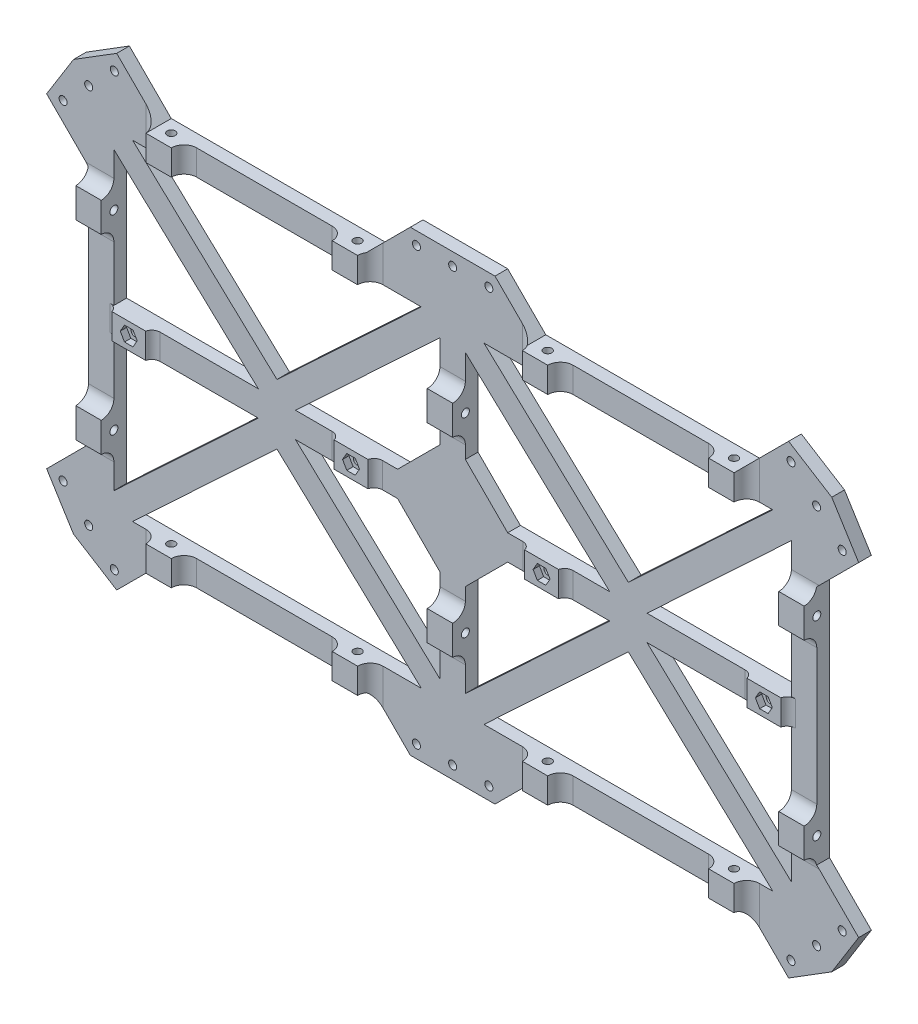
from build123d import *

# Parameters (mm, degrees)
ESQUISSE1_W             = 172
ESQUISSE1_H             = 90
BOSS_EXTRU_1_DEPTH      = 3
ESQUISSE2_R             = 0.95
BOSS_EXTRU_2_DEPTH      = 3
ESQUISSE3_R             = 0.95
ENL_V_MAT_EXTRU_1_DEPTH = 3
ENL_V_MAT_EXTRU_2_REACH = 112.527
ESQUISSE4_R             = 0.95
ESQUISSE5_W             = 8
ESQUISSE5_H             = 6
BOSS_EXTRU_3_DEPTH      = 1.5
CONG_1_R                = 2
ESQUISSE6_W             = 6
ESQUISSE6_H             = 7
ESQUISSE6_H_2           = 6
BOSS_EXTRU_4_DEPTH      = 3
ENL_V_MAT_EXTRU_3_REACH = 140.593
ESQUISSE7_R             = 0.95
ENL_V_MAT_EXTRU_4_REACH = 140.593
ESQUISSE8_R             = 0.95
CONG_2_R                = 3
ENL_V_MAT_EXTRU_5_REACH = 192.084
ESQUISSE9_R             = 0.95
ENL_V_MAT_EXTRU_6_REACH = 115.259
ESQUISSE10_R            = 0.95
ENL_V_MAT_EXTRU_7_REACH = 186.351
ESQUISSE11_R            = 0.95


with BuildPart() as part:
    # Esquisse1 → Boss.-Extru.1 (new body)
    with BuildSketch(Plane.XY):
        Rectangle(ESQUISSE1_W, ESQUISSE1_H)
        Polygon((-7.392425614, -39), (-75.607574386, -39), (-58.857104999, -23.337223431), (-58.701018232, -23.191272168), (-41.5, -7.107203172), align=None, mode=Mode.SUBTRACT)
        Polygon((-80, -34.892796828), (-80, -3), (-45.892425614, -3), (-62.798981768, -18.808727832), align=None, mode=Mode.SUBTRACT)
        Polygon((-3, -3), (-3, -34.892796828), (-37.107574386, -3), align=None, mode=Mode.SUBTRACT)
        Polygon((41.5, -7.107203172), (58.701018232, -23.191272168), (58.857104999, -23.337223431), (75.607574386, -39), (7.392425614, -39), align=None, mode=Mode.SUBTRACT)
        Polygon((37.107574386, -3), (3, -34.892796828), (3, -3), align=None, mode=Mode.SUBTRACT)
        Polygon((80, -34.892796828), (62.798981768, -18.808727832), (45.892425614, -3), (80, -3), align=None, mode=Mode.SUBTRACT)
        Polygon((-80, 3), (-80, 34.892796828), (-62.798981768, 18.808727832), (-45.892425614, 3), align=None, mode=Mode.SUBTRACT)
        Polygon((-34.550705308, 5.390838618), (-3, 34.892796828), (-3, 3), (-37.107574386, 3), align=None, mode=Mode.SUBTRACT)
        Polygon((-58.857104999, 23.337223431), (-75.607574386, 39), (-7.392425614, 39), (-41.5, 7.107203172), (-58.701018232, 23.191272168), align=None, mode=Mode.SUBTRACT)
        Polygon((3, 3), (3, 34.892796828), (34.550705308, 5.390838618), (37.107574386, 3), align=None, mode=Mode.SUBTRACT)
        Polygon((62.798981768, 18.808727832), (80, 34.892796828), (80, 3), (45.892425614, 3), align=None, mode=Mode.SUBTRACT)
        Polygon((75.607574386, 39), (58.857104999, 23.337223431), (58.701018232, 23.191272168), (41.5, 7.107203172), (7.392425614, 39), align=None, mode=Mode.SUBTRACT)
    extrude(amount=BOSS_EXTRU_1_DEPTH)

    # Esquisse2 → Boss.-Extru.2 (add)
    # profile 1 of 10: a face of its own
    with BuildSketch(Plane.XY.offset(3)):
        with BuildLine():
            Line((-85.005339898, 45), (-69.45370132, 45))
            Line((-69.45370132, 45), (-79.341722304, 54.888020984))
            Line((-79.341722304, 54.888020984), (-89.535533906, 48.535533906))
            Line((-89.535533906, 48.535533906), (-95.888020984, 38.341722304))
            Line((-95.888020984, 38.341722304), (-86, 28.45370132))
            Line((-86, 28.45370132), (-86, 44.005339898))
            ThreePointArc((-86, 44.005339898), (-86.625988463, 45.625988463), (-85.005339898, 45))
        make_face()
        with Locations((-92, 38.908474042)):
            Circle(ESQUISSE2_R, mode=Mode.SUBTRACT)
        with Locations((-79.908474042, 51)):
            Circle(ESQUISSE2_R, mode=Mode.SUBTRACT)
    # profile 2 of 10: a face of its own
    with BuildSketch(Plane.XY.offset(3)):
        Polygon((10, 54), (0, 54), (-10, 54), (-19, 45), (-10.3, 45), (10.3, 45), (19, 45), align=None)
        with Locations((-8.55, 51)):
            Circle(ESQUISSE2_R, mode=Mode.SUBTRACT)
        with Locations((0, 51)):
            Circle(ESQUISSE2_R, mode=Mode.SUBTRACT)
        with Locations((8.55, 51)):
            Circle(ESQUISSE2_R, mode=Mode.SUBTRACT)
    # profile 3 of 10: a face of its own
    with BuildSketch(Plane.XY.offset(3)):
        with BuildLine():
            Line((79.341722304, 54.888020984), (69.45370132, 45))
            Line((69.45370132, 45), (85.005339898, 45))
            ThreePointArc((85.005339898, 45), (85.977125154, 45.903961262), (86.904237021, 44.954237021))
            ThreePointArc((86.904237021, 44.954237021), (86.641977826, 44.298864924), (86, 44.005339898))
            Line((86, 44.005339898), (86, 28.45370132))
            Line((86, 28.45370132), (95.888020984, 38.341722304))
            Line((95.888020984, 38.341722304), (89.535533906, 48.535533906))
            Line((89.535533906, 48.535533906), (79.341722304, 54.888020984))
        make_face()
        with Locations((92, 38.908474042)):
            Circle(ESQUISSE2_R, mode=Mode.SUBTRACT)
        with Locations((79.908474042, 51)):
            Circle(ESQUISSE2_R, mode=Mode.SUBTRACT)
    # profile 4 of 10: a face of its own
    with BuildSketch(Plane.XY.offset(3)):
        with BuildLine():
            Line((95.888020984, -38.341722304), (86, -28.45370132))
            Line((86, -28.45370132), (86, -44.005339898))
            ThreePointArc((86, -44.005339898), (86.641977826, -44.298864924), (86.904237021, -44.954237021))
            ThreePointArc((86.904237021, -44.954237021), (85.977125154, -45.903961262), (85.005339898, -45))
            Line((85.005339898, -45), (69.45370132, -45))
            Line((69.45370132, -45), (79.341722304, -54.888020984))
            Line((79.341722304, -54.888020984), (89.535533906, -48.535533906))
            Line((89.535533906, -48.535533906), (95.888020984, -38.341722304))
        make_face()
        with Locations((79.908474042, -51)):
            Circle(ESQUISSE2_R, mode=Mode.SUBTRACT)
        with Locations((92, -38.908474042)):
            Circle(ESQUISSE2_R, mode=Mode.SUBTRACT)
    # profile 5 of 10: a face of its own
    with BuildSketch(Plane.XY.offset(3)):
        Polygon((19, -45), (-19, -45), (-10, -54), (0, -54), (10, -54), align=None)
        with Locations((-8.55, -51)):
            Circle(ESQUISSE2_R, mode=Mode.SUBTRACT)
        with Locations((0, -51)):
            Circle(ESQUISSE2_R, mode=Mode.SUBTRACT)
        with Locations((8.55, -51)):
            Circle(ESQUISSE2_R, mode=Mode.SUBTRACT)
    # profile 6 of 10: a face of its own
    with BuildSketch(Plane.XY.offset(3)):
        with BuildLine():
            Line((-86, -44.005339898), (-86, -28.45370132))
            Line((-86, -28.45370132), (-95.888020984, -38.341722304))
            Line((-95.888020984, -38.341722304), (-89.535533906, -48.535533906))
            Line((-89.535533906, -48.535533906), (-79.341722304, -54.888020984))
            Line((-79.341722304, -54.888020984), (-69.45370132, -45))
            Line((-69.45370132, -45), (-85.005339898, -45))
            ThreePointArc((-85.005339898, -45), (-86.625988463, -45.625988463), (-86, -44.005339898))
        make_face()
        with Locations((-79.908474042, -51)):
            Circle(ESQUISSE2_R, mode=Mode.SUBTRACT)
        with Locations((-92, -38.908474042)):
            Circle(ESQUISSE2_R, mode=Mode.SUBTRACT)
    # profile 7 of 10: a face of its own
    with BuildSketch(Plane.XY.offset(3)):
        Polygon((-3, -3), (-13, -3), (-3, -13), align=None)
    # profile 8 of 10: a face of its own
    with BuildSketch(Plane.XY.offset(3)):
        Polygon((3, -3), (3, -13), (13, -3), align=None)
    # profile 9 of 10: a face of its own
    with BuildSketch(Plane.XY.offset(3)):
        Polygon((13, 3), (3, 13), (3, 3), align=None)
    # profile 10 of 10: a face of its own
    with BuildSketch(Plane.XY.offset(3)):
        Polygon((-3, 13), (-13, 3), (-3, 3), align=None)
    extrude(amount=-BOSS_EXTRU_2_DEPTH)

    # Esquisse3 → Enlèv. mat.-Extru.1 (cut)
    with BuildSketch(Plane.XY.offset(3)):
        with Locations((-85.954237021, 44.954237021)):
            Circle(ESQUISSE3_R)
        with Locations((85.954237021, 44.954237021)):
            Circle(ESQUISSE3_R)
        with Locations((85.954237021, -44.954237021)):
            Circle(ESQUISSE3_R)
        with Locations((-85.954237021, -44.954237021)):
            Circle(ESQUISSE3_R)
    extrude(amount=-ENL_V_MAT_EXTRU_1_DEPTH, mode=Mode.SUBTRACT)

    # Esquisse4 → Enlèv. mat.-Extru.2 (cut, up to next)
    with BuildSketch(Plane.XY.offset(3), mode=Mode.PRIVATE) as enl_v_mat_extru_2_sk1:
        with Locations((-22.5, 0)):
            Circle(ESQUISSE4_R)
    enl_v_mat_extru_2_tool1 = extrude(enl_v_mat_extru_2_sk1.sketch, amount=-ENL_V_MAT_EXTRU_2_REACH, mode=Mode.PRIVATE) & part.part
    # Esquisse4 → Enlèv. mat.-Extru.2 (cut, up to next)
    with BuildSketch(Plane.XY.offset(3), mode=Mode.PRIVATE) as enl_v_mat_extru_2_sk2:
        with Locations((-75, 0)):
            Circle(ESQUISSE4_R)
    enl_v_mat_extru_2_tool2 = extrude(enl_v_mat_extru_2_sk2.sketch, amount=-ENL_V_MAT_EXTRU_2_REACH, mode=Mode.PRIVATE) & part.part
    # Esquisse4 → Enlèv. mat.-Extru.2 (cut, up to next)
    with BuildSketch(Plane.XY.offset(3), mode=Mode.PRIVATE) as enl_v_mat_extru_2_sk3:
        with Locations((22.5, 0)):
            Circle(ESQUISSE4_R)
    enl_v_mat_extru_2_tool3 = extrude(enl_v_mat_extru_2_sk3.sketch, amount=-ENL_V_MAT_EXTRU_2_REACH, mode=Mode.PRIVATE) & part.part
    # Esquisse4 → Enlèv. mat.-Extru.2 (cut, up to next)
    with BuildSketch(Plane.XY.offset(3), mode=Mode.PRIVATE) as enl_v_mat_extru_2_sk4:
        with Locations((75, 0)):
            Circle(ESQUISSE4_R)
    enl_v_mat_extru_2_tool4 = extrude(enl_v_mat_extru_2_sk4.sketch, amount=-ENL_V_MAT_EXTRU_2_REACH, mode=Mode.PRIVATE) & part.part
    add(enl_v_mat_extru_2_tool1.solids().sort_by_distance((-22.5, 0, 3))[0], mode=Mode.SUBTRACT)
    add(enl_v_mat_extru_2_tool2.solids().sort_by_distance((-75, 0, 3))[0], mode=Mode.SUBTRACT)
    add(enl_v_mat_extru_2_tool3.solids().sort_by_distance((22.5, 0, 3))[0], mode=Mode.SUBTRACT)
    add(enl_v_mat_extru_2_tool4.solids().sort_by_distance((75, 0, 3))[0], mode=Mode.SUBTRACT)

    # Esquisse5 → Boss.-Extru.3 (add)
    # profile 1 of 4: a face of its own
    with BuildSketch(Plane.XY.offset(3)):
        with Locations((-22.5, 0)):
            Rectangle(ESQUISSE5_W, ESQUISSE5_H)
        Polygon((-20.5, 0), (-21.5, 1.732050808), (-23.5, 1.732050808), (-24.5, 0), (-23.5, -1.732050808), (-21.5, -1.732050808), align=None, mode=Mode.SUBTRACT)
    # profile 2 of 4: a face of its own
    with BuildSketch(Plane.XY.offset(3)):
        with Locations((-75, 0)):
            Rectangle(ESQUISSE5_W, ESQUISSE5_H)
        Polygon((-73, 0), (-74, 1.732050808), (-76, 1.732050808), (-77, 0), (-76, -1.732050808), (-74, -1.732050808), align=None, mode=Mode.SUBTRACT)
    # profile 3 of 4: a face of its own
    with BuildSketch(Plane.XY.offset(3)):
        with Locations((22.5, 0)):
            Rectangle(ESQUISSE5_W, ESQUISSE5_H)
        Polygon((21.5, -1.732050808), (20.5, 0), (21.5, 1.732050808), (23.5, 1.732050808), (24.5, 0), (23.5, -1.732050808), align=None, mode=Mode.SUBTRACT)
    # profile 4 of 4: a face of its own
    with BuildSketch(Plane.XY.offset(3)):
        with Locations((75, 0)):
            Rectangle(ESQUISSE5_W, ESQUISSE5_H)
        Polygon((74, -1.732050808), (73, 0), (74, 1.732050808), (76, 1.732050808), (77, 0), (76, -1.732050808), align=None, mode=Mode.SUBTRACT)
    extrude(amount=BOSS_EXTRU_3_DEPTH)

    # Congé1
    # the kernel refuses this fillet: 2 mm, written as the material it adds along each edge
    with BuildSketch(Plane(origin=(-26.5, -3, 3), x_dir=(-1, 0, 0), z_dir=(0, 1, 0)), Plane(origin=(-18.5, 3, 3), x_dir=(1, 0, 0), z_dir=(0, -1, 0)), Plane(origin=(-79, -3, 3), x_dir=(-1, 0, 0), z_dir=(0, 1, 0)), Plane(origin=(-71, 3, 3), x_dir=(1, 0, 0), z_dir=(0, -1, 0))) as cong_1_piece_1:
        with BuildLine():
            CenterArc((1.936491673, 2), CONG_1_R, 194.477512186, 75.522487814)
            Line((0, 1.5), (0, 0))
            Line((0, 0), (1.936491673, 0))
        make_face()
    extrude(amount=6)
    with BuildSketch(Plane(origin=(18.5, 3, 3), x_dir=(-1, 0, 0), z_dir=(0, -1, 0)), Plane(origin=(26.5, -3, 3), x_dir=(1, 0, 0), z_dir=(0, 1, 0)), Plane(origin=(71, 3, 3), x_dir=(-1, 0, 0), z_dir=(0, -1, 0)), Plane(origin=(79, -3, 3), x_dir=(1, 0, 0), z_dir=(0, 1, 0))) as cong_1_piece_2:
        with BuildLine():
            CenterArc((1.936491673, -2), CONG_1_R, 90, 75.522487814)
            Line((0, -1.5), (0, 0))
            Line((0, 0), (1.936491673, 0))
        make_face()
    extrude(amount=6)

    # Esquisse6 → Boss.-Extru.4 (add)
    with BuildSketch(Plane.XY.offset(3)):
        with Locations((-83, -22.5)):
            Rectangle(ESQUISSE6_W, ESQUISSE6_H)
        with Locations((-83, 22.5)):
            Rectangle(ESQUISSE6_W, ESQUISSE6_H)
        with Locations((83, -22.5)):
            Rectangle(ESQUISSE6_W, ESQUISSE6_H)
        with Locations((83, 22.5)):
            Rectangle(ESQUISSE6_W, ESQUISSE6_H)
        with Locations((-66.45370132, 42)):
            Rectangle(ESQUISSE6_W, ESQUISSE6_H_2)
        with Locations((22.45370132, 42)):
            Rectangle(ESQUISSE6_W, ESQUISSE6_H_2)
        with Locations((-22.45370132, 42)):
            Rectangle(ESQUISSE6_W, ESQUISSE6_H_2)
        with Locations((66.45370132, 42)):
            Rectangle(ESQUISSE6_W, ESQUISSE6_H_2)
        with Locations((66.45370132, -42)):
            Rectangle(ESQUISSE6_W, ESQUISSE6_H_2)
        with Locations((22.45370132, -42)):
            Rectangle(ESQUISSE6_W, ESQUISSE6_H_2)
        with Locations((-22.45370132, -42)):
            Rectangle(ESQUISSE6_W, ESQUISSE6_H_2)
        with Locations((-66.45370132, -42)):
            Rectangle(ESQUISSE6_W, ESQUISSE6_H_2)
        with Locations((0, 22.5)):
            Rectangle(ESQUISSE6_W, ESQUISSE6_H)
        with Locations((0, -22.5)):
            Rectangle(ESQUISSE6_W, ESQUISSE6_H)
    extrude(amount=BOSS_EXTRU_4_DEPTH)

    # Esquisse7 → Enlèv. mat.-Extru.3 (cut, up to next)
    with BuildSketch(Plane.XZ.offset(45), mode=Mode.PRIVATE) as enl_v_mat_extru_3_sk1:
        with Locations(Location((-66.45370132, 3, 0), (0, 0, 270))):
            Circle(ESQUISSE7_R)
    enl_v_mat_extru_3_tool1 = extrude(enl_v_mat_extru_3_sk1.sketch, amount=-ENL_V_MAT_EXTRU_3_REACH, mode=Mode.PRIVATE) & part.part
    # Esquisse7 → Enlèv. mat.-Extru.3 (cut, up to next)
    with BuildSketch(Plane.XZ.offset(45), mode=Mode.PRIVATE) as enl_v_mat_extru_3_sk2:
        with Locations(Location((-22.45370132, 3, 0), (0, 0, 270))):
            Circle(ESQUISSE7_R)
    enl_v_mat_extru_3_tool2 = extrude(enl_v_mat_extru_3_sk2.sketch, amount=-ENL_V_MAT_EXTRU_3_REACH, mode=Mode.PRIVATE) & part.part
    # Esquisse7 → Enlèv. mat.-Extru.3 (cut, up to next)
    with BuildSketch(Plane.XZ.offset(45), mode=Mode.PRIVATE) as enl_v_mat_extru_3_sk3:
        with Locations(Location((22.45370132, 3, 0), (0, 0, 270))):
            Circle(ESQUISSE7_R)
    enl_v_mat_extru_3_tool3 = extrude(enl_v_mat_extru_3_sk3.sketch, amount=-ENL_V_MAT_EXTRU_3_REACH, mode=Mode.PRIVATE) & part.part
    # Esquisse7 → Enlèv. mat.-Extru.3 (cut, up to next)
    with BuildSketch(Plane.XZ.offset(45), mode=Mode.PRIVATE) as enl_v_mat_extru_3_sk4:
        with Locations(Location((66.45370132, 3, 0), (0, 0, 270))):
            Circle(ESQUISSE7_R)
    enl_v_mat_extru_3_tool4 = extrude(enl_v_mat_extru_3_sk4.sketch, amount=-ENL_V_MAT_EXTRU_3_REACH, mode=Mode.PRIVATE) & part.part
    add(enl_v_mat_extru_3_tool1.solids().sort_by_distance((-66.453701, -45, 3))[0], mode=Mode.SUBTRACT)
    add(enl_v_mat_extru_3_tool2.solids().sort_by_distance((-22.453701, -45, 3))[0], mode=Mode.SUBTRACT)
    add(enl_v_mat_extru_3_tool3.solids().sort_by_distance((22.453701, -45, 3))[0], mode=Mode.SUBTRACT)
    add(enl_v_mat_extru_3_tool4.solids().sort_by_distance((66.453701, -45, 3))[0], mode=Mode.SUBTRACT)

    # Esquisse8 → Enlèv. mat.-Extru.4 (cut, up to next)
    with BuildSketch(Plane(origin=(0, 45, 0), x_dir=(1, 0, 0), z_dir=(0, 1, 0)), mode=Mode.PRIVATE) as enl_v_mat_extru_4_sk1:
        with Locations(Location((66.45370132, -3, 0), (0, 0, 90))):
            Circle(ESQUISSE8_R)
    enl_v_mat_extru_4_tool1 = extrude(enl_v_mat_extru_4_sk1.sketch, amount=-ENL_V_MAT_EXTRU_4_REACH, mode=Mode.PRIVATE) & part.part
    # Esquisse8 → Enlèv. mat.-Extru.4 (cut, up to next)
    with BuildSketch(Plane(origin=(0, 45, 0), x_dir=(1, 0, 0), z_dir=(0, 1, 0)), mode=Mode.PRIVATE) as enl_v_mat_extru_4_sk2:
        with Locations(Location((22.45370132, -3, 0), (0, 0, 90))):
            Circle(ESQUISSE8_R)
    enl_v_mat_extru_4_tool2 = extrude(enl_v_mat_extru_4_sk2.sketch, amount=-ENL_V_MAT_EXTRU_4_REACH, mode=Mode.PRIVATE) & part.part
    # Esquisse8 → Enlèv. mat.-Extru.4 (cut, up to next)
    with BuildSketch(Plane(origin=(0, 45, 0), x_dir=(1, 0, 0), z_dir=(0, 1, 0)), mode=Mode.PRIVATE) as enl_v_mat_extru_4_sk3:
        with Locations(Location((-22.45370132, -3, 0), (0, 0, 90))):
            Circle(ESQUISSE8_R)
    enl_v_mat_extru_4_tool3 = extrude(enl_v_mat_extru_4_sk3.sketch, amount=-ENL_V_MAT_EXTRU_4_REACH, mode=Mode.PRIVATE) & part.part
    # Esquisse8 → Enlèv. mat.-Extru.4 (cut, up to next)
    with BuildSketch(Plane(origin=(0, 45, 0), x_dir=(1, 0, 0), z_dir=(0, 1, 0)), mode=Mode.PRIVATE) as enl_v_mat_extru_4_sk4:
        with Locations(Location((-66.45370132, -3, 0), (0, 0, 90))):
            Circle(ESQUISSE8_R)
    enl_v_mat_extru_4_tool4 = extrude(enl_v_mat_extru_4_sk4.sketch, amount=-ENL_V_MAT_EXTRU_4_REACH, mode=Mode.PRIVATE) & part.part
    add(enl_v_mat_extru_4_tool1.solids().sort_by_distance((66.453701, 45, 3))[0], mode=Mode.SUBTRACT)
    add(enl_v_mat_extru_4_tool2.solids().sort_by_distance((22.453701, 45, 3))[0], mode=Mode.SUBTRACT)
    add(enl_v_mat_extru_4_tool3.solids().sort_by_distance((-22.453701, 45, 3))[0], mode=Mode.SUBTRACT)
    add(enl_v_mat_extru_4_tool4.solids().sort_by_distance((-66.453701, 45, 3))[0], mode=Mode.SUBTRACT)

    # Congé2
    # the kernel refuses this fillet: 3 mm, written as the material it adds along each edge
    with BuildSketch(Plane(origin=(-80, -26, 3), x_dir=(0, -1, 0), z_dir=(-1, 0, 0)), Plane(origin=(-86, -19, 3), x_dir=(0, 1, 0), z_dir=(1, 0, 0)), Plane(origin=(-86, 26, 3), x_dir=(0, 1, 0), z_dir=(1, 0, 0)), Plane(origin=(86, -26, 3), x_dir=(0, -1, 0), z_dir=(-1, 0, 0)), Plane(origin=(80, 26, 3), x_dir=(0, 1, 0), z_dir=(1, 0, 0)), Plane(origin=(86, 19, 3), x_dir=(0, -1, 0), z_dir=(-1, 0, 0)), Plane(origin=(-25.45370132, 39, 3), x_dir=(-1, 0, 0), z_dir=(0, 1, 0)), Plane(origin=(-19.45370132, 45, 3), x_dir=(1, 0, 0), z_dir=(0, -1, 0)), Plane(origin=(63.45370132, 45, 3), x_dir=(0, 0, 1), z_dir=(0, -1, 0)), Plane(origin=(25.45370132, -39, 3), x_dir=(1, 0, 0), z_dir=(0, -1, 0)), Plane(origin=(19.45370132, -45, 3), x_dir=(-1, 0, 0), z_dir=(0, 1, 0)), Plane(origin=(-63.45370132, -45, 3), x_dir=(0, 0, 1), z_dir=(0, 1, 0)), Plane(origin=(3, 19, 3), x_dir=(0, -1, 0), z_dir=(-1, 0, 0)), Plane(origin=(-3, 26, 3), x_dir=(0, 1, 0), z_dir=(1, 0, 0))) as cong_2_piece_1:
        with BuildLine():
            CenterArc((CONG_2_R, CONG_2_R), CONG_2_R, 180, 90)
            Line((0, CONG_2_R), (0, 0))
            Line((0, 0), (CONG_2_R, 0))
        make_face()
    extrude(amount=6)
    with BuildSketch(Plane(origin=(-80, -26, 3), x_dir=(0, -1, 0), z_dir=(-1, 0, 0))) as cong_2_piece_2_section:
        with BuildLine():
            CenterArc((CONG_2_R, CONG_2_R), CONG_2_R, 180, 90)
            Line((0, CONG_2_R), (0, 0))
            Line((0, 0), (CONG_2_R, 0))
        make_face()
    cong_2_piece_2 = extrude(amount=13.5, mode=Mode.PRIVATE)
    cong_2_piece_2 = split(cong_2_piece_2, bisect_by=Plane(origin=(-86.163732674, -28.617433994, 3.010004121), z_dir=(0.7071067811865461, -0.7071067811865489, 0)), keep=Keep.TOP, mode=Mode.PRIVATE)
    add(cong_2_piece_2)
    with BuildSketch(Plane(origin=(-93.5, 26, 3), x_dir=(0, 1, 0), z_dir=(1, 0, 0))) as cong_2_piece_3_section:
        with BuildLine():
            CenterArc((CONG_2_R, CONG_2_R), CONG_2_R, 180, 90)
            Line((0, CONG_2_R), (0, 0))
            Line((0, 0), (CONG_2_R, 0))
        make_face()
    cong_2_piece_3 = extrude(amount=13.5, mode=Mode.PRIVATE)
    cong_2_piece_3 = split(cong_2_piece_3, bisect_by=Plane(origin=(-86.163732674, 28.617433994, 3.010004121), z_dir=(0.7071067811865461, 0.7071067811865489, 0)), keep=Keep.TOP, mode=Mode.PRIVATE)
    add(cong_2_piece_3)
    with BuildSketch(Plane(origin=(-80, 19, 3), x_dir=(0, 0, 1), z_dir=(-1, 0, 0)), Plane(origin=(80, -19, 3), x_dir=(0, 0, 1), z_dir=(1, 0, 0)), Plane(origin=(-63.45370132, 45, 3), x_dir=(0, 0, 1), z_dir=(0, -1, 0)), Plane(origin=(19.45370132, 45, 3), x_dir=(-1, 0, 0), z_dir=(0, -1, 0)), Plane(origin=(25.45370132, 39, 3), x_dir=(1, 0, 0), z_dir=(0, 1, 0)), Plane(origin=(63.45370132, -45, 3), x_dir=(0, 0, 1), z_dir=(0, 1, 0)), Plane(origin=(-19.45370132, -45, 3), x_dir=(1, 0, 0), z_dir=(0, 1, 0)), Plane(origin=(-25.45370132, -39, 3), x_dir=(-1, 0, 0), z_dir=(0, -1, 0)), Plane(origin=(-3, -26, 3), x_dir=(0, -1, 0), z_dir=(1, 0, 0)), Plane(origin=(3, -19, 3), x_dir=(0, 1, 0), z_dir=(-1, 0, 0))) as cong_2_piece_4:
        with BuildLine():
            CenterArc((CONG_2_R, -CONG_2_R), CONG_2_R, 90, 90)
            Line((0, -CONG_2_R), (0, 0))
            Line((0, 0), (CONG_2_R, 0))
        make_face()
    extrude(amount=6)
    with BuildSketch(Plane(origin=(93.5, -26, 3), x_dir=(0, -1, 0), z_dir=(-1, 0, 0))) as cong_2_piece_5_section:
        with BuildLine():
            CenterArc((CONG_2_R, CONG_2_R), CONG_2_R, 180, 90)
            Line((0, CONG_2_R), (0, 0))
            Line((0, 0), (CONG_2_R, 0))
        make_face()
    cong_2_piece_5 = extrude(amount=13.5, mode=Mode.PRIVATE)
    cong_2_piece_5 = split(cong_2_piece_5, bisect_by=Plane(origin=(86.163732674, -28.617433994, 3.010004121), z_dir=(-0.7071067811865459, -0.7071067811865491, 0)), keep=Keep.TOP, mode=Mode.PRIVATE)
    add(cong_2_piece_5)
    with BuildSketch(Plane(origin=(80, 26, 3), x_dir=(0, 1, 0), z_dir=(1, 0, 0))) as cong_2_piece_6_section:
        with BuildLine():
            CenterArc((CONG_2_R, CONG_2_R), CONG_2_R, 180, 90)
            Line((0, CONG_2_R), (0, 0))
            Line((0, 0), (CONG_2_R, 0))
        make_face()
    cong_2_piece_6 = extrude(amount=13.5, mode=Mode.PRIVATE)
    cong_2_piece_6 = split(cong_2_piece_6, bisect_by=Plane(origin=(86.163732674, 28.617433994, 3.010004121), z_dir=(-0.7071067811865459, 0.7071067811865491, 0)), keep=Keep.TOP, mode=Mode.PRIVATE)
    add(cong_2_piece_6)
    with BuildSketch(Plane(origin=(-69.45370132, 39, 3), x_dir=(-1, 0, 0), z_dir=(0, 1, 0))) as cong_2_piece_7_section:
        with BuildLine():
            CenterArc((CONG_2_R, CONG_2_R), CONG_2_R, 180, 90)
            Line((0, CONG_2_R), (0, 0))
            Line((0, 0), (CONG_2_R, 0))
        make_face()
    cong_2_piece_7 = extrude(amount=13.5, mode=Mode.PRIVATE)
    cong_2_piece_7 = split(cong_2_piece_7, bisect_by=Plane(origin=(-68.288753229, 43.835051908, 3.670103817), z_dir=(-0.7071067811865387, -0.7071067811865565, 0)), keep=Keep.TOP, mode=Mode.PRIVATE)
    add(cong_2_piece_7)
    with BuildSketch(Plane(origin=(-19.45370132, 52.5, 3), x_dir=(1, 0, 0), z_dir=(0, -1, 0))) as cong_2_piece_8_section:
        with BuildLine():
            CenterArc((CONG_2_R, CONG_2_R), CONG_2_R, 180, 90)
            Line((0, CONG_2_R), (0, 0))
            Line((0, 0), (CONG_2_R, 0))
        make_face()
    cong_2_piece_8 = extrude(amount=21, mode=Mode.PRIVATE)
    cong_2_piece_8 = split(cong_2_piece_8, bisect_by=Plane(origin=(-18.009809269, 45, 3.253081686), z_dir=(0, 1, 0)), keep=Keep.TOP, mode=Mode.PRIVATE)
    cong_2_piece_8 = split(cong_2_piece_8, bisect_by=Plane(origin=(-18.257356952, 45.742643048, 3.253081686), z_dir=(0.7071067811865465, -0.7071067811865487, 0)), keep=Keep.TOP, mode=Mode.PRIVATE)
    add(cong_2_piece_8)
    with BuildSketch(Plane(origin=(19.45370132, 52.5, 3), x_dir=(-1, 0, 0), z_dir=(0, -1, 0))) as cong_2_piece_9_section:
        with BuildLine():
            CenterArc((CONG_2_R, -CONG_2_R), CONG_2_R, 90, 90)
            Line((0, -CONG_2_R), (0, 0))
            Line((0, 0), (CONG_2_R, 0))
        make_face()
    cong_2_piece_9 = extrude(amount=13.5, mode=Mode.PRIVATE)
    cong_2_piece_9 = split(cong_2_piece_9, bisect_by=Plane(origin=(18.257356952, 45.742643048, 3.253081686), z_dir=(-0.7071067811865482, -0.7071067811865469, 0)), keep=Keep.TOP, mode=Mode.PRIVATE)
    add(cong_2_piece_9)
    with BuildSketch(Plane(origin=(69.45370132, 39, 3), x_dir=(1, 0, 0), z_dir=(0, 1, 0))) as cong_2_piece_10_section:
        with BuildLine():
            CenterArc((CONG_2_R, -CONG_2_R), CONG_2_R, 90, 90)
            Line((0, -CONG_2_R), (0, 0))
            Line((0, 0), (CONG_2_R, 0))
        make_face()
    cong_2_piece_10 = extrude(amount=13.5, mode=Mode.PRIVATE)
    cong_2_piece_10 = split(cong_2_piece_10, bisect_by=Plane(origin=(68.288753229, 43.835051908, 3.670103817), z_dir=(0.7071067811865387, -0.7071067811865565, 0)), keep=Keep.TOP, mode=Mode.PRIVATE)
    add(cong_2_piece_10)
    with BuildSketch(Plane(origin=(69.45370132, -39, 3), x_dir=(1, 0, 0), z_dir=(0, -1, 0))) as cong_2_piece_11_section:
        with BuildLine():
            CenterArc((CONG_2_R, CONG_2_R), CONG_2_R, 180, 90)
            Line((0, CONG_2_R), (0, 0))
            Line((0, 0), (CONG_2_R, 0))
        make_face()
    cong_2_piece_11 = extrude(amount=13.5, mode=Mode.PRIVATE)
    cong_2_piece_11 = split(cong_2_piece_11, bisect_by=Plane(origin=(68.288753229, -43.835051908, 3.670103817), z_dir=(0.7071067811865387, 0.7071067811865565, 0)), keep=Keep.TOP, mode=Mode.PRIVATE)
    add(cong_2_piece_11)
    with BuildSketch(Plane(origin=(19.45370132, -52.5, 3), x_dir=(-1, 0, 0), z_dir=(0, 1, 0))) as cong_2_piece_12_section:
        with BuildLine():
            CenterArc((CONG_2_R, CONG_2_R), CONG_2_R, 180, 90)
            Line((0, CONG_2_R), (0, 0))
            Line((0, 0), (CONG_2_R, 0))
        make_face()
    cong_2_piece_12 = extrude(amount=21, mode=Mode.PRIVATE)
    cong_2_piece_12 = split(cong_2_piece_12, bisect_by=Plane(origin=(18.009809269, -45, 3.253081686), z_dir=(0, -1, 0)), keep=Keep.TOP, mode=Mode.PRIVATE)
    cong_2_piece_12 = split(cong_2_piece_12, bisect_by=Plane(origin=(18.257356952, -45.742643048, 3.253081686), z_dir=(-0.7071067811865482, 0.7071067811865469, 0)), keep=Keep.TOP, mode=Mode.PRIVATE)
    add(cong_2_piece_12)
    with BuildSketch(Plane(origin=(-19.45370132, -52.5, 3), x_dir=(1, 0, 0), z_dir=(0, 1, 0))) as cong_2_piece_13_section:
        with BuildLine():
            CenterArc((CONG_2_R, -CONG_2_R), CONG_2_R, 90, 90)
            Line((0, -CONG_2_R), (0, 0))
            Line((0, 0), (CONG_2_R, 0))
        make_face()
    cong_2_piece_13 = extrude(amount=13.5, mode=Mode.PRIVATE)
    cong_2_piece_13 = split(cong_2_piece_13, bisect_by=Plane(origin=(-18.257356952, -45.742643048, 3.253081686), z_dir=(0.7071067811865465, 0.7071067811865487, 0)), keep=Keep.TOP, mode=Mode.PRIVATE)
    add(cong_2_piece_13)
    with BuildSketch(Plane(origin=(-69.45370132, -39, 3), x_dir=(-1, 0, 0), z_dir=(0, -1, 0))) as cong_2_piece_14_section:
        with BuildLine():
            CenterArc((CONG_2_R, -CONG_2_R), CONG_2_R, 90, 90)
            Line((0, -CONG_2_R), (0, 0))
            Line((0, 0), (CONG_2_R, 0))
        make_face()
    cong_2_piece_14 = extrude(amount=13.5, mode=Mode.PRIVATE)
    cong_2_piece_14 = split(cong_2_piece_14, bisect_by=Plane(origin=(-68.288753229, -43.835051908, 3.670103817), z_dir=(-0.7071067811865387, 0.7071067811865565, 0)), keep=Keep.TOP, mode=Mode.PRIVATE)
    add(cong_2_piece_14)

    # Esquisse9 → Enlèv. mat.-Extru.5 (cut, up to next)
    with BuildSketch(Plane.ZY.offset(86), mode=Mode.PRIVATE) as enl_v_mat_extru_5_sk1:
        with Locations(Location((3, -22.5, 0), (0, 0, 270))):
            Circle(ESQUISSE9_R)
    enl_v_mat_extru_5_tool1 = extrude(enl_v_mat_extru_5_sk1.sketch, amount=-ENL_V_MAT_EXTRU_5_REACH, mode=Mode.PRIVATE) & part.part
    # Esquisse9 → Enlèv. mat.-Extru.5 (cut, up to next)
    with BuildSketch(Plane.ZY.offset(86), mode=Mode.PRIVATE) as enl_v_mat_extru_5_sk2:
        with Locations(Location((3, 22.5, 0), (0, 0, 270))):
            Circle(ESQUISSE9_R)
    enl_v_mat_extru_5_tool2 = extrude(enl_v_mat_extru_5_sk2.sketch, amount=-ENL_V_MAT_EXTRU_5_REACH, mode=Mode.PRIVATE) & part.part
    add(enl_v_mat_extru_5_tool1.solids().sort_by_distance((-86, -22.5, 3))[0], mode=Mode.SUBTRACT)
    add(enl_v_mat_extru_5_tool2.solids().sort_by_distance((-86, 22.5, 3))[0], mode=Mode.SUBTRACT)

    # Esquisse10 → Enlèv. mat.-Extru.6 (cut, up to next)
    with BuildSketch(Plane.ZY.offset(3), mode=Mode.PRIVATE) as enl_v_mat_extru_6_sk1:
        with Locations(Location((3, -22.5, 0), (0, 0, 270))):
            Circle(ESQUISSE10_R)
    enl_v_mat_extru_6_tool1 = extrude(enl_v_mat_extru_6_sk1.sketch, amount=-ENL_V_MAT_EXTRU_6_REACH, mode=Mode.PRIVATE) & part.part
    # Esquisse10 → Enlèv. mat.-Extru.6 (cut, up to next)
    with BuildSketch(Plane.ZY.offset(3), mode=Mode.PRIVATE) as enl_v_mat_extru_6_sk2:
        with Locations(Location((3, 22.5, 0), (0, 0, 270))):
            Circle(ESQUISSE10_R)
    enl_v_mat_extru_6_tool2 = extrude(enl_v_mat_extru_6_sk2.sketch, amount=-ENL_V_MAT_EXTRU_6_REACH, mode=Mode.PRIVATE) & part.part
    add(enl_v_mat_extru_6_tool1.solids().sort_by_distance((-3, -22.5, 3))[0], mode=Mode.SUBTRACT)
    add(enl_v_mat_extru_6_tool2.solids().sort_by_distance((-3, 22.5, 3))[0], mode=Mode.SUBTRACT)

    # Esquisse11 → Enlèv. mat.-Extru.7 (cut, up to next)
    with BuildSketch(Plane.ZY.offset(-80), mode=Mode.PRIVATE) as enl_v_mat_extru_7_sk1:
        with Locations(Location((3, 22.5, 0), (0, 0, 270))):
            Circle(ESQUISSE11_R)
    enl_v_mat_extru_7_tool1 = extrude(enl_v_mat_extru_7_sk1.sketch, amount=-ENL_V_MAT_EXTRU_7_REACH, mode=Mode.PRIVATE) & part.part
    # Esquisse11 → Enlèv. mat.-Extru.7 (cut, up to next)
    with BuildSketch(Plane.ZY.offset(-80), mode=Mode.PRIVATE) as enl_v_mat_extru_7_sk2:
        with Locations(Location((3, -22.473199207, 0), (0, 0, 270))):
            Circle(ESQUISSE11_R)
    enl_v_mat_extru_7_tool2 = extrude(enl_v_mat_extru_7_sk2.sketch, amount=-ENL_V_MAT_EXTRU_7_REACH, mode=Mode.PRIVATE) & part.part
    add(enl_v_mat_extru_7_tool1.solids().sort_by_distance((80, 22.5, 3))[0], mode=Mode.SUBTRACT)
    add(enl_v_mat_extru_7_tool2.solids().sort_by_distance((80, -22.473199, 3))[0], mode=Mode.SUBTRACT)


solid = part.part
